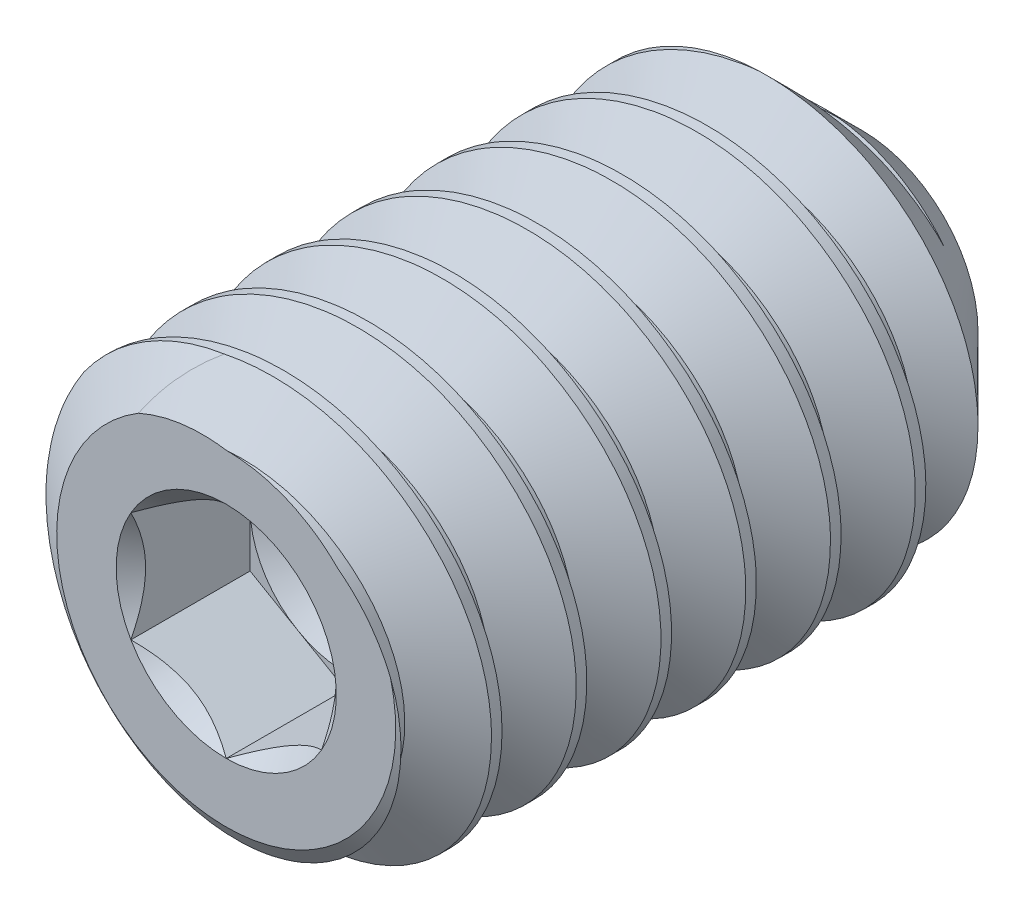
from build123d import *

# Parameters (mm, degrees)
CUT_SWEEP2_PITCH    = 0.4
CUT_EXTRUDE10_DEPTH = 0.5625


with BuildPart() as part:
    # Sketch22 → Revolve1 (revolve)
    with BuildSketch(Plane(origin=(0, 0, 0), x_dir=(0, 0, -1), z_dir=(1, 0, 0)), mode=Mode.PRIVATE) as revolve1_sk:
        Polygon((-1.335374734, 0), (-1.335374734, 0.8), (-1.195333226, 1), (1.212590173, 1), (1.664625266, 0.547964906), (1.335374734, 0), align=None)
    revolve(revolve1_sk.sketch.rotate(Axis((0, 0, -1.335374734), (0, 0, -1)), 180), axis=Axis((0, 0, -1.335374734), (0, 0, -1)))

    # Cut-Sweep2: arcs per turn and ends read off the stored shape
    # Cut-Sweep2: the profile of Sketch28 profile screwed along a right-hand helix through 8.5 turns, 6 arcs to a turn; built about Z, then put on its axis
    cut_sweep2_z = Axis((0, 0, 0), (0, 0, 1))
    cut_sweep2_corners = [(1.0003, -1.75e-07, -0.099826806), (1.0003, -1.75e-07, -0.450173216), (0.740192379, -1.29e-07, -0.300000011), (0.740192379, -1.29e-07, -0.250000011)]
    with BuildLine(mode=Mode.PRIVATE) as cut_sweep2_profile:
        Line(cut_sweep2_corners[0], cut_sweep2_corners[1])
        Line(cut_sweep2_corners[1], cut_sweep2_corners[2])
        Line(cut_sweep2_corners[2], cut_sweep2_corners[3])
        Line(cut_sweep2_corners[3], cut_sweep2_corners[0])
    cut_sweep2_cap = Face(cut_sweep2_profile.wire())
    cut_sweep2_turn_angles = [0, 30, 60, 90, 120, 150, 180, 210, 240, 270, 300, 330, 360]
    cut_sweep2_turn_weights = [1, 0.8660254037844387, 1, 0.8660254037844387, 1, 0.8660254037844387, 1, 0.8660254037844387, 1, 0.8660254037844387, 1, 0.8660254037844387, 1]
    cut_sweep2_turn_rails = [Edge.make_bspline([Vector(p[0], p[1], 0).rotate(cut_sweep2_z, cut_sweep2_turn_angles[k]) / cut_sweep2_turn_weights[k] + Vector(0, 0, p[2] + CUT_SWEEP2_PITCH * cut_sweep2_turn_angles[k] / 360) for k in range(13)], [0, 0, 0, 1, 1, 2, 2, 3, 3, 4, 4, 5, 5, 6, 6, 6], 2, cut_sweep2_turn_weights) for p in cut_sweep2_corners]
    cut_sweep2_turn_sides = [Face.make_surface_from_curves(cut_sweep2_turn_rails[p[0]], cut_sweep2_turn_rails[p[1]]) for p in [(0, 1), (1, 2), (2, 3), (3, 0)]]
    cut_sweep2_last_angles = [2880, 2910, 2940, 2970, 3000, 3030, 3060]
    cut_sweep2_last_weights = [1, 0.8660254037844387, 1, 0.8660254037844387, 1, 0.8660254037844247, 1]
    cut_sweep2_last_rails = [Edge.make_bspline([Vector(p[0], p[1], 0).rotate(cut_sweep2_z, cut_sweep2_last_angles[k]) / cut_sweep2_last_weights[k] + Vector(0, 0, p[2] + CUT_SWEEP2_PITCH * cut_sweep2_last_angles[k] / 360) for k in range(7)], [0, 0, 0, 1, 1, 2, 2, 3, 3, 3], 2, cut_sweep2_last_weights) for p in cut_sweep2_corners]
    cut_sweep2_last_sides = [Face.make_surface_from_curves(cut_sweep2_last_rails[p[0]], cut_sweep2_last_rails[p[1]]) for p in [(0, 1), (1, 2), (2, 3), (3, 0)]]
    cut_sweep2 = Plane(origin=(0, 0, -1.664625266), x_dir=(1, 0, 0), z_dir=(0, 0, 1)) * Solid(Shell([*[p.moved(Location((0, 0, CUT_SWEEP2_PITCH * i))) for i in range(8) for p in cut_sweep2_turn_sides], *cut_sweep2_last_sides, cut_sweep2_cap, cut_sweep2_cap.rotate(cut_sweep2_z, 3060).moved(Location((0, 0, CUT_SWEEP2_PITCH * 3060 / 360)))]))
    add(cut_sweep2, mode=Mode.SUBTRACT)

    # Sketch23 → Cut-Extrude10 (cut)
    with BuildSketch(Plane.XY.offset(1.335374734)):
        Polygon((0, 0.519615242), (-0.45, 0.259807621), (-0.45, -0.259807621), (0, -0.519615242), (0.45, -0.259807621), (0.45, 0.259807621), align=None)
    extrude(amount=-CUT_EXTRUDE10_DEPTH, mode=Mode.SUBTRACT)

    # Cut-Extrude11 cone 1 section (through the dimple's axis) → Cut-Extrude11 (revolve, cut)
    with BuildSketch(Plane(origin=(0, 0, 1.335374734), x_dir=(0, -1, 0), z_dir=(1, 0, 0))):
        Polygon((0, 0), (0.519615242, 0), (0, 0.519615242), align=None)
    revolve(axis=Axis((0, 0, 1.335374734), (0, 0, -1)), mode=Mode.SUBTRACT)

    # Cut-Extrude12 cone 1 section (through the dimple's axis) → Cut-Extrude12 (revolve, cut)
    with BuildSketch(Plane(origin=(0, 0, 0.772874734), x_dir=(0, -1, 0), z_dir=(1, 0, 0))):
        Polygon((0, 0), (0.45, 0), (0, 0.259807621), align=None)
    revolve(axis=Axis((0, 0, 0.772874734), (0, 0, -1)), mode=Mode.SUBTRACT)


solid = part.part
